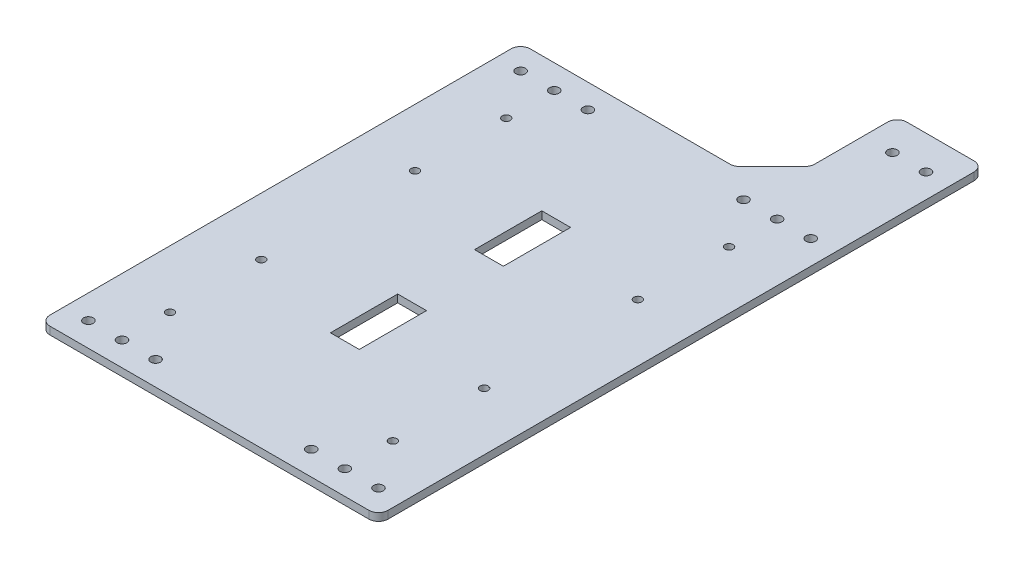
from build123d import *

# Parameters (mm, degrees)
BOSS_EXTRUDE1_DEPTH = 4
SKETCH2_R           = 2.5
SKETCH2_R_2         = 2.1
CUT_EXTRUDE1_DEPTH  = 227.373585031
SKETCH3_W           = 15
SKETCH3_H           = 35
CUT_EXTRUDE2_DEPTH  = 227.373585031
SKETCH4_R           = 2.1
CUT_EXTRUDE3_DEPTH  = 10
CHAMFER1_SIZE       = 20
FILLET1_R           = 5


with BuildPart() as part:
    # Sketch1 → Boss-Extrude1 (new body)
    with BuildSketch(Plane(origin=(0, 0, 0), x_dir=(1, 0, 0), z_dir=(0, 1, 0))):
        Polygon((-123, 125), (8, 125), (8, 190), (53, 190), (53, 125), (53, -125), (-53, -125), (-123, -125), align=None)
    extrude(amount=BOSS_EXTRUDE1_DEPTH)

    # Sketch2 → Cut-Extrude1 (cut, through all)
    with BuildSketch(Plane(origin=(0, 4, 0), x_dir=(1, 0, 0), z_dir=(0, 1, 0))):
        with Locations((-110.5, -112.5)):
            Circle(SKETCH2_R)
        with Locations((-75.5, -112.5)):
            Circle(SKETCH2_R)
        with Locations((-93, -112.5)):
            Circle(SKETCH2_R)
        with Locations((-93, -87.5)):
            Circle(SKETCH2_R_2)
        with Locations((5.5, -112.5)):
            Circle(SKETCH2_R)
        with Locations((23, -112.5)):
            Circle(SKETCH2_R)
        with Locations((40.5, -112.5)):
            Circle(SKETCH2_R)
        with Locations((23, -87.5)):
            Circle(SKETCH2_R_2)
        with Locations((23, 87.5)):
            Circle(SKETCH2_R_2)
        with Locations((40.5, 112.5)):
            Circle(SKETCH2_R)
        with Locations((23, 112.5)):
            Circle(SKETCH2_R)
        with Locations((5.5, 112.5)):
            Circle(SKETCH2_R)
        with Locations((-93, 87.5)):
            Circle(SKETCH2_R_2)
        with Locations((-93, 112.5)):
            Circle(SKETCH2_R)
        with Locations((-75.5, 112.5)):
            Circle(SKETCH2_R)
        with Locations((-110.5, 112.5)):
            Circle(SKETCH2_R)
        with Locations((40.5, 172.5)):
            Circle(SKETCH2_R)
        with Locations((23, 172.5)):
            Circle(SKETCH2_R)
    extrude(amount=-CUT_EXTRUDE1_DEPTH, mode=Mode.SUBTRACT)

    # Sketch3 → Cut-Extrude2 (cut, through all)
    with BuildSketch(Plane.XZ):
        with Locations((-34.5, 37.5)):
            Rectangle(SKETCH3_W, SKETCH3_H)
        with Locations((-34.5, -37.5)):
            Rectangle(SKETCH3_W, SKETCH3_H)
    extrude(amount=-CUT_EXTRUDE2_DEPTH, mode=Mode.SUBTRACT)

    # Sketch4 → Cut-Extrude3 (cut)
    with BuildSketch(Plane.XZ):
        with Locations((-93, 40)):
            Circle(SKETCH4_R)
        with Locations((-93, -40)):
            Circle(SKETCH4_R)
        with Locations((23, -40)):
            Circle(SKETCH4_R)
        with Locations((23, 40)):
            Circle(SKETCH4_R)
    extrude(amount=-CUT_EXTRUDE3_DEPTH, mode=Mode.SUBTRACT)

    # Chamfer1
    chamfer1_edges = [part.edges().sort_by_distance(p)[0] for p in [
        (8, 2, -125),
    ]]
    chamfer(chamfer1_edges, length=CHAMFER1_SIZE)

    # Fillet1
    fillet1_edges = [part.edges().sort_by_distance(p)[0] for p in [
        (53, 2, 125),
        (-123, 2, 125),
        (-123, 2, -125),
        (53, 2, -190),
        (8, 2, -190),
        (-12, 2, -125),
        (8, 2, -145),
    ]]
    fillet(fillet1_edges, radius=FILLET1_R)


solid = part.part
